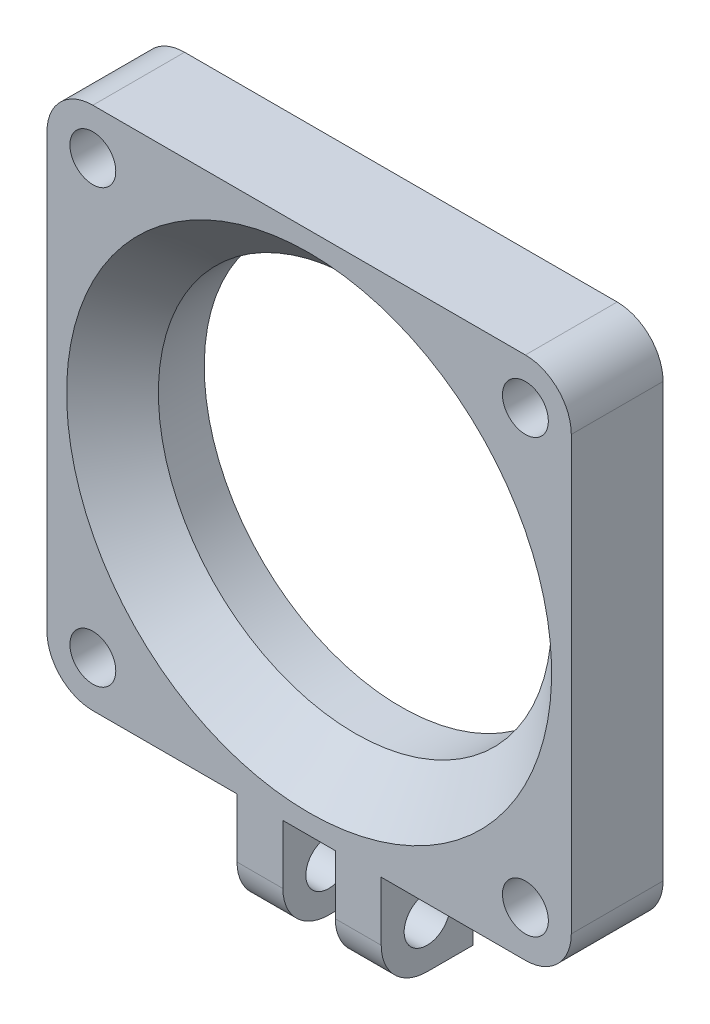
from build123d import *

# Parameters (mm, degrees)
BOSS_EXTRUDE1_DEPTH   = 7
CUT_EXTRUDE2_REACH    = 31.138
SKETCH3_R             = 1.75
SKETCH7_W             = 3.5
SKETCH7_H             = 28
BOSS_EXTRUDE2_DEPTH   = 7
CUT_EXTRUDE3_DEPTH    = 39.512984823
SKETCH9_R             = 1.75
CUT_EXTRUDE4_DEPTH    = 39.512984823
SKETCH13_R            = 15
CUT_EXTRUDE5_DEPTH    = 36.114099732
BODY_MOVE_COPY1_ANGLE = 90


with BuildPart() as part:
    # Sketch1 → Boss-Extrude1 (new body)
    with BuildSketch(Plane(origin=(0, 0, 0), x_dir=(1, 0, 0), z_dir=(0, 1, 0))):
        with BuildLine():
            Line((-16.5, 20), (16.5, 20))
            ThreePointArc((16.5, 20), (18.974873734, 18.974873734), (20, 16.5))
            Line((20, 16.5), (20, -16.5))
            ThreePointArc((20, -16.5), (18.974873734, -18.974873734), (16.5, -20))
            Line((16.5, -20), (-16.5, -20))
            ThreePointArc((-16.5, -20), (-18.974873734, -18.974873734), (-20, -16.5))
            Line((-20, -16.5), (-20, 16.5))
            ThreePointArc((-20, 16.5), (-18.974873734, 18.974873734), (-16.5, 20))
        make_face()
    extrude(amount=BOSS_EXTRUDE1_DEPTH)

    # Sketch3 → Cut-Extrude2 (cut, up to next)
    with BuildSketch(Plane(origin=(0, 7, 0), x_dir=(1, 0, 0), z_dir=(0, 1, 0)), mode=Mode.PRIVATE) as cut_extrude2_sk1:
        with Locations((-16.5, 16.5)):
            Circle(SKETCH3_R)
    cut_extrude2_tool1 = extrude(cut_extrude2_sk1.sketch, amount=-CUT_EXTRUDE2_REACH, mode=Mode.PRIVATE) & part.part
    # Sketch3 → Cut-Extrude2 (cut, up to next)
    with BuildSketch(Plane(origin=(0, 7, 0), x_dir=(1, 0, 0), z_dir=(0, 1, 0)), mode=Mode.PRIVATE) as cut_extrude2_sk2:
        with Locations((16.5, 16.5)):
            Circle(SKETCH3_R)
    cut_extrude2_tool2 = extrude(cut_extrude2_sk2.sketch, amount=-CUT_EXTRUDE2_REACH, mode=Mode.PRIVATE) & part.part
    # Sketch3 → Cut-Extrude2 (cut, up to next)
    with BuildSketch(Plane(origin=(0, 7, 0), x_dir=(1, 0, 0), z_dir=(0, 1, 0)), mode=Mode.PRIVATE) as cut_extrude2_sk3:
        with Locations((16.5, -16.5)):
            Circle(SKETCH3_R)
    cut_extrude2_tool3 = extrude(cut_extrude2_sk3.sketch, amount=-CUT_EXTRUDE2_REACH, mode=Mode.PRIVATE) & part.part
    # Sketch3 → Cut-Extrude2 (cut, up to next)
    with BuildSketch(Plane(origin=(0, 7, 0), x_dir=(1, 0, 0), z_dir=(0, 1, 0)), mode=Mode.PRIVATE) as cut_extrude2_sk4:
        with Locations((-16.5, -16.5)):
            Circle(SKETCH3_R)
    cut_extrude2_tool4 = extrude(cut_extrude2_sk4.sketch, amount=-CUT_EXTRUDE2_REACH, mode=Mode.PRIVATE) & part.part
    add(cut_extrude2_tool1.solids().sort_by_distance((-16.5, 7, -16.5))[0], mode=Mode.SUBTRACT)
    add(cut_extrude2_tool2.solids().sort_by_distance((16.5, 7, -16.5))[0], mode=Mode.SUBTRACT)
    add(cut_extrude2_tool3.solids().sort_by_distance((16.5, 7, 16.5))[0], mode=Mode.SUBTRACT)
    add(cut_extrude2_tool4.solids().sort_by_distance((-16.5, 7, 16.5))[0], mode=Mode.SUBTRACT)

    # Sketch7 → Boss-Extrude2 (add)
    with BuildSketch(Plane.XZ):
        with Locations((3.75, 14)):
            Rectangle(SKETCH7_W, SKETCH7_H)
        with Locations((-3.75, 14)):
            Rectangle(SKETCH7_W, SKETCH7_H)
    extrude(amount=-BOSS_EXTRUDE2_DEPTH)

    # Sketch8 → Cut-Extrude3 (cut, through all)
    with BuildSketch(Plane(origin=(5.5, 0, 0), x_dir=(0, 0, -1), z_dir=(1, 0, 0))):
        with BuildLine():
            ThreePointArc((-28, 3.5), (-26.974873734, 5.974873734), (-24.5, 7))
            Line((-24.5, 7), (-28, 7))
            Line((-28, 7), (-28, 3.5))
        make_face()
    extrude(amount=-CUT_EXTRUDE3_DEPTH, mode=Mode.SUBTRACT)

    # Sketch9 → Cut-Extrude4 (cut, through all)
    with BuildSketch(Plane(origin=(5.5, 0, 0), x_dir=(0, 0, -1), z_dir=(1, 0, 0))):
        with Locations((-24.5, 3.5)):
            Circle(SKETCH9_R)
    extrude(amount=-CUT_EXTRUDE4_DEPTH, mode=Mode.SUBTRACT)

    # Sketch13 → Cut-Extrude5 (cut, through all)
    with BuildSketch(Plane.XZ):
        Circle(SKETCH13_R)
    extrude(amount=-CUT_EXTRUDE5_DEPTH, mode=Mode.SUBTRACT)

    # Sketch14 → Cut-Revolve1 (revolve, cut)
    with BuildSketch(Plane(origin=(0, 0, 0), x_dir=(0, 0, -1), z_dir=(1, 0, 0))):
        Polygon((0, 0), (0, 7), (18.5, 7), (15, 3.5), (15, 0), align=None)
    revolve(axis=Axis((0, 7, 0), (0, -1, 0)), mode=Mode.SUBTRACT)


with BuildPart() as part_1:
    # Body-Move/Copy1: moved
    add(part.part.rotate(Axis((0, 3.5, 4), (1, 0, 0)), BODY_MOVE_COPY1_ANGLE))


solid = part_1.part
